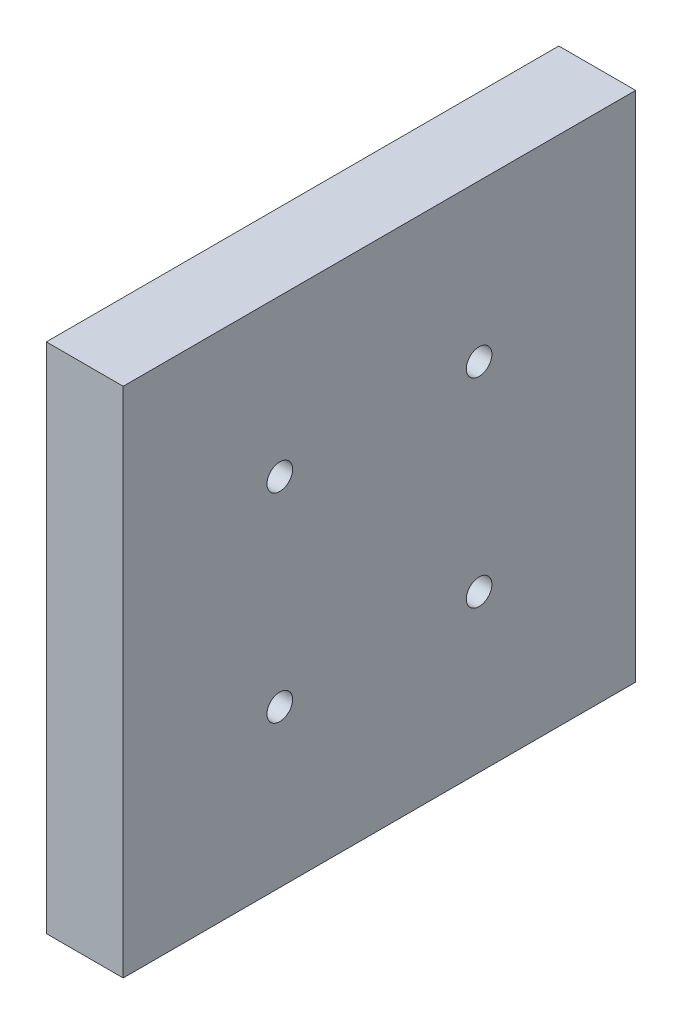
from build123d import *

# Parameters (mm, degrees)
SKETCH2_W           = 100
SKETCH2_H           = 100
BOSS_EXTRUDE1_DEPTH = 15
SKETCH3_R           = 2.5
CUT_EXTRUDE1_DEPTH  = 15


with BuildPart() as part:
    # Sketch2 → Boss-Extrude1 (new body)
    with BuildSketch(Plane(origin=(0, 0, 0), x_dir=(0, 0, -1), z_dir=(1, 0, 0))):
        Rectangle(SKETCH2_W, SKETCH2_H)
    extrude(amount=BOSS_EXTRUDE1_DEPTH)

    # Sketch3 → Cut-Extrude1 (cut)
    with BuildSketch(Plane(origin=(15, 0, 0), x_dir=(0, 0, -1), z_dir=(1, 0, 0))):
        with Locations((-19.445436483, 19.445436483)):
            Circle(SKETCH3_R)
        with Locations((19.445436483, 19.445436483)):
            Circle(SKETCH3_R)
        with Locations((19.445436483, -19.445436483)):
            Circle(SKETCH3_R)
        with Locations((-19.445436483, -19.445436483)):
            Circle(SKETCH3_R)
    extrude(amount=-CUT_EXTRUDE1_DEPTH, mode=Mode.SUBTRACT)


solid = part.part
